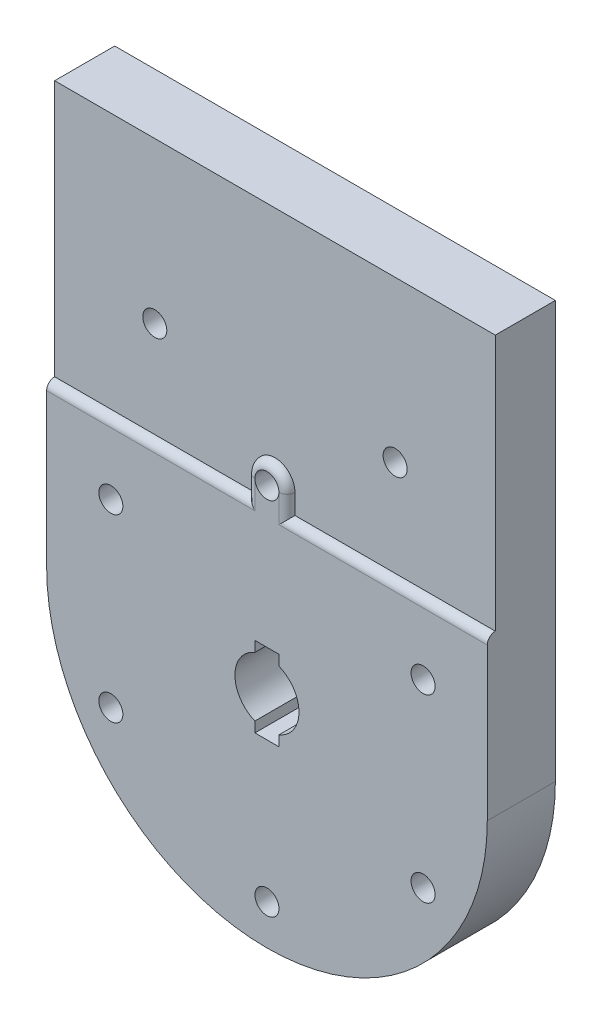
from build123d import *

# Parameters (mm, degrees)
ESQUISSE1_W             = 100
ESQUISSE1_H             = 100.548113933
BOSS_EXTRU_1_DEPTH      = 8.5
ESQUISSE2_R             = 1.5
ENL_V_MAT_EXTRU_1_DEPTH = 73.637800077
ENL_V_MAT_EXTRU_6_DEPTH = 1
CONG_4_R                = 1
ESQUISSE4_R             = 3
ENL_V_MAT_EXTRU_7_DEPTH = 4


with BuildPart() as part:
    # Esquisse1 → Boss.-Extru.1 (new body)
    with BuildSketch(Plane.XY):
        with Locations((0, 1.725943033)):
            Rectangle(ESQUISSE1_W, ESQUISSE1_H)
        with BuildLine():
            Line((-1.5, 3.708099244), (-1.5, 5))
            Line((-1.5, 5), (1.5, 5))
            Line((1.5, 5), (1.5, 3.708099244))
            ThreePointArc((1.5, 3.708099244), (3.31662479, 2.236067977), (4, 0))
            ThreePointArc((4, 0), (3.31662479, -2.236067977), (1.5, -3.708099244))
            Line((1.5, -3.708099244), (1.5, -5))
            Line((1.5, -5), (-1.5, -5))
            Line((-1.5, -5), (-1.5, -3.708099244))
            ThreePointArc((-1.5, -3.708099244), (-4, 0), (-1.5, 3.708099244))
        make_face(mode=Mode.SUBTRACT)
    extrude(amount=BOSS_EXTRU_1_DEPTH)

    # Esquisse2 → Enlèv. mat.-Extru.1 (cut, through all)
    with BuildSketch(Plane.XY.offset(8.5)):
        with BuildLine():
            ThreePointArc((27.5, 0), (0, -27.5), (-27.5, 0))
            Line((-27.5, 0), (-27.5, 52))
            Line((-27.5, 52), (-50, 52))
            Line((-50, 52), (-50, -48.548113933))
            Line((-50, -48.548113933), (50, -48.548113933))
            Line((50, -48.548113933), (50, 52))
            Line((50, 52), (27.5, 52))
            Line((27.5, 52), (27.5, 0))
        make_face()
        with Locations((0, 22.5)):
            Circle(ESQUISSE2_R)
        with Locations((19.485571585, 11.25)):
            Circle(ESQUISSE2_R)
        with Locations((19.485571585, -11.25)):
            Circle(ESQUISSE2_R)
        with Locations((0, -22.5)):
            Circle(ESQUISSE2_R)
        with Locations((-19.485571585, -11.25)):
            Circle(ESQUISSE2_R)
        with Locations((-19.485571585, 11.25)):
            Circle(ESQUISSE2_R)
        with Locations((-15, 32)):
            Circle(ESQUISSE2_R)
        with Locations((15, 32)):
            Circle(ESQUISSE2_R)
    extrude(amount=-ENL_V_MAT_EXTRU_1_DEPTH, mode=Mode.SUBTRACT)

    # Esquisse3 → Enlèv. mat.-Extru.6 (cut)
    with BuildSketch(Plane.XY.offset(8.5)):
        with BuildLine():
            Line((27.5, 52), (-27.5, 52))
            Line((-27.5, 52), (-27.5, 20))
            Line((-27.5, 20), (-2.5, 20))
            Line((-2.5, 20), (-2.5, 22.5))
            ThreePointArc((-2.5, 22.5), (0, 25), (2.5, 22.5))
            Line((2.5, 22.5), (2.5, 20))
            Line((2.5, 20), (27.5, 20))
            Line((27.5, 20), (27.5, 52))
        make_face()
    extrude(amount=-ENL_V_MAT_EXTRU_6_DEPTH, mode=Mode.SUBTRACT)

    # Congé4
    cong_4_edges = [part.edges().sort_by_distance(p)[0] for p in [
        (-15, 20, 8.5),
        (15, 20, 8.5),
        (2.5, 21.25, 8.5),
        (-2.5, 21.25, 8.5),
        (0, 25, 8.5),
    ]]
    fillet(cong_4_edges, radius=CONG_4_R - 0.0001)  # a hair under: the kernel refuses the full size

    # Esquisse4 → Enlèv. mat.-Extru.7 (cut)
    with BuildSketch(Plane(origin=(0, 0, 0), x_dir=(-1, 0, 0), z_dir=(0, 0, -1))):
        with Locations((0, 22.5)):
            Circle(ESQUISSE4_R)
        with Locations((19.485571585, 11.25)):
            Circle(ESQUISSE4_R)
        with Locations((19.485571585, -11.25)):
            Circle(ESQUISSE4_R)
        with Locations((0, -22.5)):
            Circle(ESQUISSE4_R)
        with Locations((-19.485571585, -11.25)):
            Circle(ESQUISSE4_R)
        with Locations((-19.485571585, 11.25)):
            Circle(ESQUISSE4_R)
    extrude(amount=-ENL_V_MAT_EXTRU_7_DEPTH, mode=Mode.SUBTRACT)


solid = part.part
